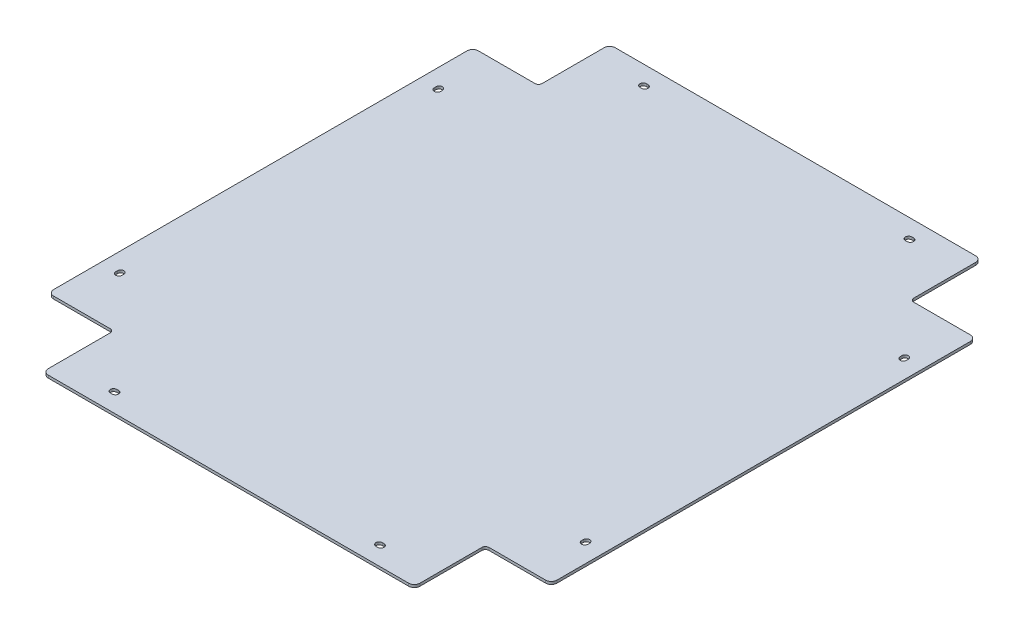
from build123d import *

# Parameters (mm, degrees)
SM_BASE_FLANGE_1_DEPTH = 1.5
CUT_EXTRUDE_1_DEPTH    = 215.212814743
FILLET_1_R             = 3.2
FILLET_3_R             = 2
CUT_EXTRUDE_2_DEPTH    = 10


# Sheet-metal steps are written as plain solids
with BuildPart() as part:
    # Sketch 1 → Базовая кромка1 (new body)
    with BuildSketch(Plane(origin=(0, 0, 0), x_dir=(1, 0, 0), z_dir=(0, 1, 0))):
        with BuildLine():
            Line((-112.2, -160.2), (112.2, -160.2))
            ThreePointArc((112.2, -160.2), (133.413203436, -151.413203436), (142.2, -130.2))
            Line((142.2, -130.2), (142.2, 130.2))
            ThreePointArc((142.2, 130.2), (133.413203436, 151.413203436), (112.2, 160.2))
            Line((112.2, 160.2), (-112.2, 160.2))
            ThreePointArc((-112.2, 160.2), (-133.413203436, 151.413203436), (-142.2, 130.2))
            Line((-142.2, 130.2), (-142.2, -130.2))
            ThreePointArc((-142.2, -130.2), (-133.413203436, -151.413203436), (-112.2, -160.2))
        make_face()
    extrude(amount=-SM_BASE_FLANGE_1_DEPTH)

    # Sketch 2 → Вырез-Вытянуть1 (cut, through all)
    with BuildSketch(Plane.XZ.offset(1.5)):
        with BuildLine():
            Line((105, 120), (142.2, 120))
            Line((142.2, 120), (142.2, 130.2))
            ThreePointArc((142.2, 130.2), (133.413203436, 151.413203436), (112.2, 160.2))
            Line((112.2, 160.2), (105, 160.2))
            Line((105, 160.2), (105, 120))
        make_face()
        with BuildLine():
            Line((142.2, -130.2), (142.2, -120))
            Line((142.2, -120), (105, -120))
            Line((105, -120), (105, -160.2))
            Line((105, -160.2), (112.2, -160.2))
            ThreePointArc((112.2, -160.2), (133.413203436, -151.413203436), (142.2, -130.2))
        make_face()
        with BuildLine():
            Line((-112.2, -160.2), (-105, -160.2))
            Line((-105, -160.2), (-105, -120))
            Line((-105, -120), (-142.2, -120))
            Line((-142.2, -120), (-142.2, -130.2))
            ThreePointArc((-142.2, -130.2), (-133.413203436, -151.413203436), (-112.2, -160.2))
        make_face()
        with BuildLine():
            Line((-105, 120), (-105, 160.2))
            Line((-105, 160.2), (-112.2, 160.2))
            ThreePointArc((-112.2, 160.2), (-133.413203436, 151.413203436), (-142.2, 130.2))
            Line((-142.2, 130.2), (-142.2, 120))
            Line((-142.2, 120), (-105, 120))
        make_face()
    extrude(amount=-CUT_EXTRUDE_1_DEPTH, mode=Mode.SUBTRACT)

    # Скругление1
    fillet_1_edges = [part.edges().sort_by_distance(p)[0] for p in [
        (-142.2, -0.75, 120),
        (-105, -0.75, 160.2),
        (-105, -0.75, -160.2),
        (-142.2, -0.75, -120),
        (105, -0.75, -160.2),
        (142.2, -0.75, -120),
        (105, -0.75, 160.2),
        (142.2, -0.75, 120),
    ]]
    fillet(fillet_1_edges, radius=FILLET_1_R)

    # Скругление3
    fillet_3_edges = [part.edges().sort_by_distance(p)[0] for p in [
        (-105, -0.75, 120),
        (-105, -0.75, -120),
        (105, -0.75, -120),
        (105, -0.75, 120),
    ]]
    fillet(fillet_3_edges, radius=FILLET_3_R)

    # Эскиз4 → Вырез-Вытянуть2 (cut)
    with BuildSketch(Plane(origin=(0, 0, 0), x_dir=(1, 0, 0), z_dir=(0, 1, 0))):
        with BuildLine():
            Line((-133.4, -90.5), (-133.4, -89.5))
            ThreePointArc((-133.4, -89.5), (-131.6, -87.7), (-129.8, -89.5))
            Line((-129.8, -89.5), (-129.8, -90.5))
            ThreePointArc((-129.8, -90.5), (-131.6, -92.3), (-133.4, -90.5))
        make_face()
        with BuildLine():
            Line((-74.5, -151.4), (-75.5, -151.4))
            ThreePointArc((-75.5, -151.4), (-77.3, -149.6), (-75.5, -147.8))
            Line((-75.5, -147.8), (-74.5, -147.8))
            ThreePointArc((-74.5, -147.8), (-72.7, -149.6), (-74.5, -151.4))
        make_face()
        with BuildLine():
            Line((-74.5, 151.4), (-75.5, 151.4))
            ThreePointArc((-75.5, 151.4), (-77.3, 149.6), (-75.5, 147.8))
            Line((-75.5, 147.8), (-74.5, 147.8))
            ThreePointArc((-74.5, 147.8), (-72.7, 149.6), (-74.5, 151.4))
        make_face()
        with BuildLine():
            Line((-133.4, 90.5), (-133.4, 89.5))
            ThreePointArc((-133.4, 89.5), (-131.6, 87.7), (-129.8, 89.5))
            Line((-129.8, 89.5), (-129.8, 90.5))
            ThreePointArc((-129.8, 90.5), (-131.6, 92.3), (-133.4, 90.5))
        make_face()
        with BuildLine():
            Line((74.5, 151.4), (75.5, 151.4))
            ThreePointArc((75.5, 151.4), (77.3, 149.6), (75.5, 147.8))
            Line((75.5, 147.8), (74.5, 147.8))
            ThreePointArc((74.5, 147.8), (72.7, 149.6), (74.5, 151.4))
        make_face()
        with BuildLine():
            Line((133.4, 90.5), (133.4, 89.5))
            ThreePointArc((133.4, 89.5), (131.6, 87.7), (129.8, 89.5))
            Line((129.8, 89.5), (129.8, 90.5))
            ThreePointArc((129.8, 90.5), (131.6, 92.3), (133.4, 90.5))
        make_face()
        with BuildLine():
            Line((133.4, -90.5), (133.4, -89.5))
            ThreePointArc((133.4, -89.5), (131.6, -87.7), (129.8, -89.5))
            Line((129.8, -89.5), (129.8, -90.5))
            ThreePointArc((129.8, -90.5), (131.6, -92.3), (133.4, -90.5))
        make_face()
        with BuildLine():
            Line((74.5, -151.4), (75.5, -151.4))
            ThreePointArc((75.5, -151.4), (77.3, -149.6), (75.5, -147.8))
            Line((75.5, -147.8), (74.5, -147.8))
            ThreePointArc((74.5, -147.8), (72.7, -149.6), (74.5, -151.4))
        make_face()
    extrude(amount=-CUT_EXTRUDE_2_DEPTH, mode=Mode.SUBTRACT)


solid = part.part
